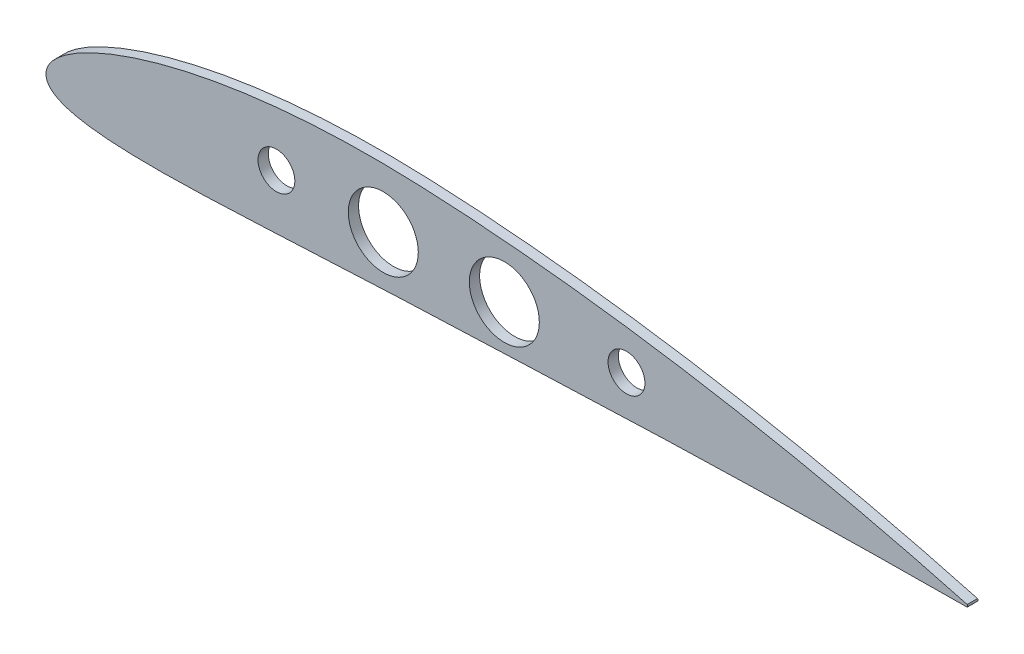
from build123d import *

# Parameters (mm, degrees)
SKETCH_1_R      = 5
SKETCH_1_R_2    = 9.5
EXTRUDE_1_DEPTH = 1.4


with BuildPart() as part:
    # Эскиз1 → Бобышка-Вытянуть1 (new, symmetric)
    with BuildSketch(Plane.XY):
        with BuildLine():
            ThreePointArc((250, 0.315), (250.130477272, 0), (250, -0.315))
            add(Edge.make_bspline(
                [(0.047975, 0.621425), (0.02271382, 0.373490086), (-0.027820789, -0.122499975), (0.077991212, -0.88443459), (0.34969565, -1.63883807), (0.814331135, -2.365068924), (1.46348078, -3.039275245), (2.290973017, -3.66099947), (3.30592875, -4.235779621), (4.535255619, -4.773674144), (6.029745688, -5.282192165), (7.868981215, -5.765316676), (10.168831392, -6.221716593), (13.075438189, -6.639618731), (16.728115363, -6.992956738), (21.189952096, -7.247345145), (26.399984416, -7.376638849), (32.197398564, -7.376256913), (38.397806759, -7.26143658), (44.857621768, -7.056641358), (51.486543096, -6.786453532), (58.230980932, -6.472324587), (65.052094606, -6.132852265), (71.910772709, -5.784005177), (78.771375576, -5.439680454), (85.61049861, -5.110951253), (92.43210759, -4.804953326), (99.25503119, -4.531981655), (106.097378405, -4.278274671), (112.96921168, -4.003089926), (119.864404255, -3.723176184), (126.773860473, -3.440067296), (133.681563213, -3.1586956), (140.581870407, -2.88238072), (147.472013762, -2.613922958), (154.352602411, -2.355626415), (161.225044134, -2.109369921), (168.090869746, -1.876634074), (174.951578522, -1.658643104), (181.808595966, -1.456378123), (188.663234462, -1.270383377), (195.516645168, -1.101112884), (202.369532894, -0.948617189), (211.49919029, -0.767742353), (220.603098666, -0.619939742), (229.617630172, -0.50292618), (236.087353854, -0.431514192), (241.980776913, -0.376520461), (246.558970011, -0.339535886), (249.120490965, -0.321271242), (250, -0.315)],
                knots=[0, 0, 0, 0, 0.002941446, 0.005884319, 0.00901613, 0.012364547, 0.016007934, 0.020036845, 0.024573728, 0.029783835, 0.03589701, 0.04324044, 0.052275965, 0.063634589, 0.077983176, 0.095698161, 0.116520086, 0.13966073, 0.16431217, 0.18991889, 0.216157201, 0.242837762, 0.269833583, 0.296993022, 0.324123272, 0.351139107, 0.378035509, 0.404946016, 0.431960837, 0.459078395, 0.4863474, 0.51364083, 0.540928595, 0.568176028, 0.595379569, 0.622543445, 0.64967326, 0.676775201, 0.703855228, 0.730918775, 0.757971338, 0.785017763, 0.812061651, 0.839103366, 0.893099152, 0.919831065, 0.945809917, 0.969680601, 0.989589706, 1, 1, 1, 1], degree=3))
            add(Edge.make_bspline(
                [(250, 0.315), (249.15566774, 0.545019818), (246.720175698, 1.208516243), (242.391332083, 2.358339053), (236.849761204, 3.787625364), (230.779918279, 5.298008837), (224.455917947, 6.812866028), (218.030543496, 8.291610632), (211.562405045, 9.719735057), (205.072411509, 11.092374932), (198.567970913, 12.407850726), (192.052369914, 13.665297924), (185.527619973, 14.864093303), (178.995338991, 16.003404779), (172.457064741, 17.082388115), (165.914317095, 18.099827841), (159.368680729, 19.054501815), (152.821805128, 19.944885603), (146.275439401, 20.769282183), (139.731359791, 21.525676113), (133.19183673, 22.212004249), (126.658683026, 22.825721429), (120.136770918, 23.363973266), (113.628567141, 23.824677324), (107.152732037, 24.200242594), (100.741095693, 24.49839951), (94.411752715, 24.686649768), (88.155917993, 24.74009565), (81.949043055, 24.658849144), (75.780520592, 24.441013808), (69.653692942, 24.081884821), (63.575410502, 23.578006361), (57.555189551, 22.924946658), (51.605762688, 22.119065522), (45.744400311, 21.156564432), (39.995857594, 20.03537139), (34.397919842, 18.756316234), (29.010382104, 17.327615608), (23.925798408, 15.771864921), (19.27067884, 14.134269434), (15.179098391, 12.483335438), (11.74047579, 10.895610995), (8.959371869, 9.429577365), (6.76089118, 8.108603199), (5.033709748, 6.924638055), (3.671694933, 5.854229664), (2.592101123, 4.871305369), (1.738175669, 3.952595743), (1.06987083, 3.080946373), (0.57164541, 2.241622102), (0.215773899, 1.430785397), (0.102255582, 0.883241695), (0.047975, 0.621425)],
                knots=[0, 0, 0, 0, 0.0101622, 0.029313053, 0.052011605, 0.076619468, 0.101948061, 0.127526132, 0.153184131, 0.178867888, 0.204557903, 0.230245712, 0.255925967, 0.281594302, 0.30724642, 0.332878042, 0.358484538, 0.384061186, 0.409602822, 0.435103874, 0.460559416, 0.485959195, 0.51130307, 0.536551515, 0.561723366, 0.586628867, 0.611085431, 0.6352512, 0.659272176, 0.683163753, 0.706922144, 0.73053591, 0.7539832, 0.77723469, 0.800246382, 0.822950709, 0.845237155, 0.866915896, 0.887662335, 0.906968281, 0.924203157, 0.938878975, 0.950931611, 0.960693484, 0.968646729, 0.975232933, 0.980794744, 0.985583761, 0.989781539, 0.993521313, 0.996902113, 1, 1, 1, 1], degree=3))
        make_face()
        with Locations((62.532619318, 8.596197208)):
            Circle(SKETCH_1_R, mode=Mode.SUBTRACT)
        with Locations((157.532619318, 8.596197208)):
            Circle(SKETCH_1_R, mode=Mode.SUBTRACT)
        with Locations((91.532619318, 8.596197208)):
            Circle(SKETCH_1_R_2, mode=Mode.SUBTRACT)
        with Locations((124.381643129, 8.596197208)):
            Circle(SKETCH_1_R_2, mode=Mode.SUBTRACT)
    extrude(amount=EXTRUDE_1_DEPTH, both=True)


solid = part.part
